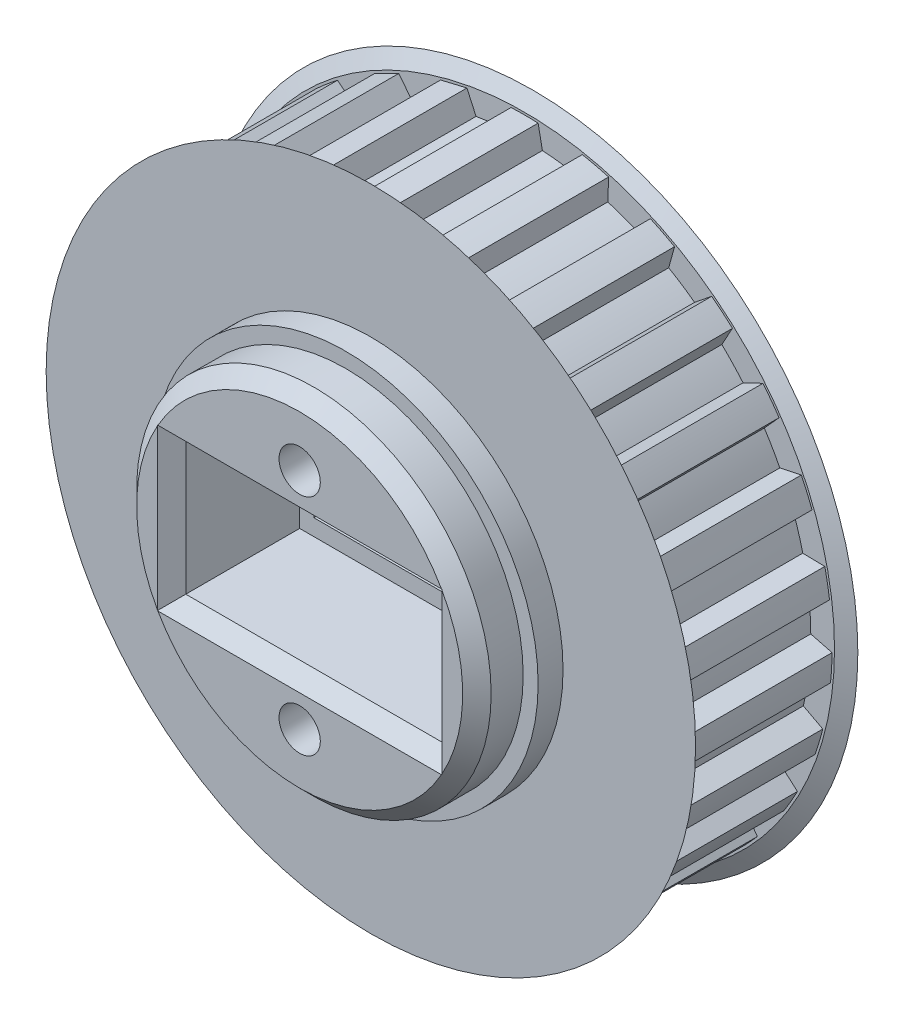
from build123d import *
from build123d.topology import SkipClean

# Parameters (mm, degrees)
CROQUIS1_R                 = 1.5
SALIENTE_EXTRUIR1_DEPTH    = 10.2
CROQUIS2_R                 = 23.5
CROQUIS2_R_2               = 1.5
SALIENTE_EXTRUIR2_DEPTH    = 0.6
SALIENTE_EXTRUIR4_START    = 4.25
CROQUIS4_R                 = 12.45
CROQUIS4_R_2               = 1.5
SALIENTE_EXTRUIR4_DEPTH    = 4.25
SALIENTE_EXTRUIR6_START    = 0.6
CROQUIS6_R                 = 23.5
CROQUIS6_R_2               = 1.5
SALIENTE_EXTRUIR6_DEPTH    = 0.6
SALIENTE_EXTRUIR5_START    = 1.75
CROQUIS5_R                 = 13.5
CROQUIS5_R_2               = 1.5
SALIENTE_EXTRUIR5_DEPTH    = 1.75
CHAFL_N2_SIZE              = 1.732050808
CHAFL_N2_SIZE_2            = 1
CROQUIS3_R                 = 12.45
CROQUIS3_R_2               = 1.5
SALIENTE_EXTRUIR7_DEPTH    = 5
CHAFL_N4_SIZE              = 1
CROQUIS7_R                 = 13.5
CROQUIS7_R_2               = 1.5
SALIENTE_EXTRUIR8_DEPTH    = 1.75
CORTAR_EXTRUIR1_DEPTH      = 36.916220425
CORTAR_EXTRUIR1_DEPTH_BACK = 36.916220425
CROQUIS8_R                 = 1.45
CROQUIS8_W                 = 16
CROQUIS8_H                 = 7
CROQUIS10_W                = 18
CROQUIS10_H                = 9.3
CORTAR_EXTRUIR3_DEPTH      = 9
CHAFL_N5_SIZE              = 1
SKETCH1_R                  = 12.45
SKETCH1_R_2                = 1.45
BOSS_EXTRUDE1_DEPTH        = 5
SKETCH2_R                  = 1.45
CUT_EXTRUDE1_DEPTH         = 38.978117247
SKETCH4_W                  = 8
SKETCH4_H                  = 7
CUT_EXTRUDE2_DEPTH         = 21
CHAMFER3_SIZE              = 1
CHAMFER2_SIZE              = 0.75


# Some blends are built 0.0001 mm under size
with BuildPart() as part:
    # Croquis1 → Saliente-Extruir1 (new body)
    with BuildSketch(Plane.XY):
        with BuildLine():
            Line((-0.95, 21.579098684), (-1.25, 20.061094188))
            ThreePointArc((-1.25, 20.061094188), (-2.333467574, 19.964090991), (-3.410100616, 19.808614636))
            Line((-3.410100616, 19.808614636), (-4.052090006, 21.216516363))
            Line((-4.052090006, 21.216516363), (-5.90087526, 20.778346209))
            Line((-5.90087526, 20.778346209), (-5.842712792, 19.232074959))
            ThreePointArc((-5.842712792, 19.232074959), (-6.874604881, 18.887821678), (-7.886361825, 18.488247542))
            Line((-7.886361825, 18.488247542), (-8.83573079, 19.710146154))
            Line((-8.83573079, 19.710146154), (-10.533632807, 18.857427711))
            Line((-10.533632807, 18.857427711), (-10.120443426, 17.366249591))
            ThreePointArc((-10.120443426, 17.366249591), (-11.045130459, 16.793305009), (-11.937467227, 16.171174237))
            Line((-11.937467227, 16.171174237), (-13.143035041, 17.141196863))
            ThreePointArc((-13.143035041, 17.141196863), (-13.884212369, 16.546559971), (-14.598519483, 15.919900405))
            Line((-14.598519483, 15.919900405), (-13.852578334, 14.564205213))
            ThreePointArc((-13.852578334, 14.564205213), (-14.620210196, 13.793456921), (-15.34502068, 12.982308744))
            Line((-15.34502068, 12.982308744), (-16.741794871, 13.648161213))
            ThreePointArc((-16.741794871, 13.648161213), (-17.325860964, 12.898625581), (-17.876396195, 12.124127147))
            Line((-17.876396195, 12.124127147), (-16.837917159, 10.977000762))
            ThreePointArc((-16.837917159, 10.977000762), (-17.407110616, 10.05), (-17.925320097, 9.093563626))
            Line((-17.925320097, 9.093563626), (-19.438000206, 9.41934966))
            ThreePointArc((-19.438000206, 9.41934966), (-19.833467909, 8.555322946), (-20.190551761, 7.674739056))
            Line((-20.190551761, 7.674739056), (-18.915519512, 6.798023359))
            ThreePointArc((-18.915519512, 6.798023359), (-19.255589198, 5.764744977), (-19.539260868, 4.714582139))
            Line((-19.539260868, 4.714582139), (-21.086297918, 4.682738527))
            ThreePointArc((-21.086297918, 4.682738527), (-21.271847465, 3.750800638), (-21.416229455, 2.811603797))
            Line((-21.416229455, 2.811603797), (-19.973381312, 2.252562756))
            ThreePointArc((-19.973381312, 2.252562756), (-20.065993981, 1.168711061), (-20.099835027, 0.081436309))
            Line((-20.099835027, 0.081436309), (-21.597827852, -0.306320251))
            ThreePointArc((-21.597827852, -0.306320251), (-21.563456219, -1.255928304), (-21.487352677, -2.203105751))
            Line((-21.487352677, -2.203105751), (-19.954472955, -2.414334087))
            ThreePointArc((-19.954472955, -2.414334087), (-19.794635836, -3.490328371), (-19.576821878, -4.556099774))
            Line((-19.576821878, -4.556099774), (-20.945013295, -5.278865225))
            ThreePointArc((-20.945013295, -5.278865225), (-20.692573466, -6.194949827), (-20.400087153, -7.099045298))
            Line((-20.400087153, -7.099045298), (-18.859813796, -6.951073555))
            ThreePointArc((-18.859813796, -6.951073555), (-18.456143748, -7.961203297), (-17.998417194, -8.948015339))
            Line((-17.998417194, -8.948015339), (-19.163047651, -9.966825208))
            ThreePointArc((-19.163047651, -9.966825208), (-18.706148722, -10.8), (-18.213047651, -11.612273475))
            Line((-18.213047651, -11.612273475), (-16.748417194, -11.113078848))
            ThreePointArc((-16.748417194, -11.113078848), (-16.122676174, -12.002887693), (-15.44971318, -12.857541081))
            Line((-15.44971318, -12.857541081), (-16.347997147, -14.117471065))
            ThreePointArc((-16.347997147, -14.117471065), (-15.711270658, -14.822819378), (-15.044138035, -15.499480984))
            Line((-15.044138035, -15.499480984), (-13.734109086, -14.675975185))
            ThreePointArc((-13.734109086, -14.675975185), (-12.920030955, -15.397493307), (-12.06811113, -16.073913455))
            Line((-12.06811113, -16.073913455), (-12.651621886, -17.507040402))
            ThreePointArc((-12.651621886, -17.507040402), (-11.869393926, -18.046536727), (-11.064195045, -18.551107461))
            Line((-11.064195045, -18.551107461), (-9.979391602, -17.4476859))
            ThreePointArc((-9.979391602, -17.4476859), (-9.020863522, -17.962016071), (-8.035914085, -18.423736994))
            Line((-8.035914085, -18.423736994), (-8.273194414, -19.95280066))
            ThreePointArc((-8.273194414, -19.95280066), (-7.387635096, -20.297360609), (-6.487778435, -20.602638932))
            Line((-6.487778435, -20.602638932), (-5.686682533, -19.278787352))
            ThreePointArc((-5.686682533, -19.278787352), (-4.635379002, -19.558201899), (-3.570498832, -19.780332103))
            Line((-3.570498832, -19.780332103), (-3.44875689, -21.32290027))
            ThreePointArc((-3.44875689, -21.32290027), (-2.507606945, -21.453948527), (-1.561604011, -21.543476807))
            Line((-1.561604011, -21.543476807), (-1.087402938, -20.070564388))
            ThreePointArc((-1.087402938, -20.070564388), (0, -20.1), (1.087402938, -20.070564388))
            Line((1.087402938, -20.070564388), (1.561604011, -21.543476807))
            ThreePointArc((1.561604011, -21.543476807), (2.507606945, -21.453948527), (3.44875689, -21.32290027))
            Line((3.44875689, -21.32290027), (3.570498832, -19.780332103))
            ThreePointArc((3.570498832, -19.780332103), (4.635379002, -19.558201899), (5.686682533, -19.278787352))
            Line((5.686682533, -19.278787352), (6.487778435, -20.602638932))
            ThreePointArc((6.487778435, -20.602638932), (7.387635096, -20.297360609), (8.273194414, -19.95280066))
            Line((8.273194414, -19.95280066), (8.035914085, -18.423736994))
            ThreePointArc((8.035914085, -18.423736994), (9.020863522, -17.962016071), (9.979391602, -17.4476859))
            Line((9.979391602, -17.4476859), (11.064195045, -18.551107461))
            ThreePointArc((11.064195045, -18.551107461), (11.869393926, -18.046536727), (12.651621886, -17.507040402))
            Line((12.651621886, -17.507040402), (12.06811113, -16.073913455))
            ThreePointArc((12.06811113, -16.073913455), (12.920030955, -15.397493307), (13.734109086, -14.675975185))
            Line((13.734109086, -14.675975185), (15.044138035, -15.499480984))
            ThreePointArc((15.044138035, -15.499480984), (15.711270658, -14.822819378), (16.347997147, -14.117471065))
            Line((16.347997147, -14.117471065), (15.44971318, -12.857541081))
            ThreePointArc((15.44971318, -12.857541081), (16.122676174, -12.002887693), (16.748417194, -11.113078848))
            Line((16.748417194, -11.113078848), (18.213047651, -11.612273475))
            ThreePointArc((18.213047651, -11.612273475), (18.706148722, -10.8), (19.163047651, -9.966825208))
            Line((19.163047651, -9.966825208), (17.998417194, -8.948015339))
            ThreePointArc((17.998417194, -8.948015339), (18.456143748, -7.961203297), (18.859813796, -6.951073555))
            Line((18.859813796, -6.951073555), (20.400087153, -7.099045298))
            ThreePointArc((20.400087153, -7.099045298), (20.692573466, -6.194949827), (20.945013295, -5.278865225))
            Line((20.945013295, -5.278865225), (19.576821878, -4.556099774))
            ThreePointArc((19.576821878, -4.556099774), (19.794635836, -3.490328371), (19.954472955, -2.414334087))
            Line((19.954472955, -2.414334087), (21.487352677, -2.203105751))
            ThreePointArc((21.487352677, -2.203105751), (21.563456219, -1.255928304), (21.597827852, -0.306320251))
            Line((21.597827852, -0.306320251), (20.099835027, 0.081436309))
            ThreePointArc((20.099835027, 0.081436309), (20.065993981, 1.168711061), (19.973381312, 2.252562756))
            Line((19.973381312, 2.252562756), (21.416229455, 2.811603797))
            ThreePointArc((21.416229455, 2.811603797), (21.271847465, 3.750800638), (21.086297918, 4.682738527))
            Line((21.086297918, 4.682738527), (19.539260868, 4.714582139))
            ThreePointArc((19.539260868, 4.714582139), (19.255589198, 5.764744977), (18.915519512, 6.798023359))
            Line((18.915519512, 6.798023359), (20.190551761, 7.674739056))
            ThreePointArc((20.190551761, 7.674739056), (19.833467909, 8.555322946), (19.438000206, 9.41934966))
            Line((19.438000206, 9.41934966), (17.925320097, 9.093563626))
            ThreePointArc((17.925320097, 9.093563626), (17.407110616, 10.05), (16.837917159, 10.977000762))
            Line((16.837917159, 10.977000762), (17.876396195, 12.124127147))
            ThreePointArc((17.876396195, 12.124127147), (17.325860964, 12.898625581), (16.741794871, 13.648161213))
            Line((16.741794871, 13.648161213), (15.34502068, 12.982308744))
            ThreePointArc((15.34502068, 12.982308744), (14.620210196, 13.793456921), (13.852578334, 14.564205213))
            Line((13.852578334, 14.564205213), (14.598519483, 15.919900405))
            ThreePointArc((14.598519483, 15.919900405), (13.884212369, 16.546559971), (13.143035041, 17.141196863))
            Line((13.143035041, 17.141196863), (11.937467227, 16.171174237))
            ThreePointArc((11.937467227, 16.171174237), (11.045130459, 16.793305009), (10.120443426, 17.366249591))
            Line((10.120443426, 17.366249591), (10.533632807, 18.857427711))
            ThreePointArc((10.533632807, 18.857427711), (9.694062292, 19.302465031), (8.83573079, 19.710146154))
            Line((8.83573079, 19.710146154), (7.886361825, 18.488247542))
            ThreePointArc((7.886361825, 18.488247542), (6.874604881, 18.887821678), (5.842712792, 19.232074959))
            Line((5.842712792, 19.232074959), (5.90087526, 20.778346209))
            ThreePointArc((5.90087526, 20.778346209), (4.981302808, 21.017769205), (4.052090006, 21.216516363))
            Line((4.052090006, 21.216516363), (3.410100616, 19.808614636))
            ThreePointArc((3.410100616, 19.808614636), (2.333467574, 19.964090991), (1.25, 20.061094188))
            Line((1.25, 20.061094188), (0.95, 21.579098684))
            ThreePointArc((0.95, 21.579098684), (0, 21.6), (-0.95, 21.579098684))
        make_face()
        Circle(CROQUIS1_R, mode=Mode.SUBTRACT)
    extrude(amount=SALIENTE_EXTRUIR1_DEPTH)

    # Croquis2 → Saliente-Extruir2 (add)
    with BuildSketch(Plane.XY.offset(10.2)):
        Circle(CROQUIS2_R)
        Circle(CROQUIS2_R_2, mode=Mode.SUBTRACT)
    extrude(amount=SALIENTE_EXTRUIR2_DEPTH)

    # Croquis4 → Saliente-Extruir4 (add)
    with BuildSketch(Plane(origin=(0, 0, 0), x_dir=(-1, 0, 0), z_dir=(0, 0, -1)).offset(SALIENTE_EXTRUIR4_START)):
        with Locations(Location((0, 0, 0), (0, 0, 180))):
            Circle(CROQUIS4_R)
        Circle(CROQUIS4_R_2, mode=Mode.SUBTRACT)
    extrude(amount=-SALIENTE_EXTRUIR4_DEPTH)

    # Croquis6 → Saliente-Extruir6 (add)
    with SkipClean():  # the faces are left unmerged after this step: merging them gives an invalid solid
        with BuildSketch(Plane(origin=(0, 0, 0), x_dir=(-1, 0, 0), z_dir=(0, 0, -1)).offset(SALIENTE_EXTRUIR6_START)):
            with Locations(Location((0, 0, 0), (0, 0, 180))):
                Circle(CROQUIS6_R)
            Circle(CROQUIS6_R_2, mode=Mode.SUBTRACT)
        extrude(amount=-SALIENTE_EXTRUIR6_DEPTH)

    # Croquis5 → Saliente-Extruir5 (add)
    with SkipClean():  # the faces are left unmerged after this step: merging them gives an invalid solid
        with BuildSketch(Plane(origin=(0, 0, -0.6), x_dir=(-1, 0, 0), z_dir=(0, 0, -1)).offset(SALIENTE_EXTRUIR5_START)):
            Circle(CROQUIS5_R)
            Circle(CROQUIS5_R_2, mode=Mode.SUBTRACT)
        extrude(amount=-SALIENTE_EXTRUIR5_DEPTH)

    # Chaflán2
    # the kernel refuses this chamfer: 1.732050808, 1 mm, written as the material it takes off along each edge
    with BuildSketch(Plane(origin=(0, 0, 0), x_dir=(1, 0, 0), z_dir=(0, 1, 0))) as chafl_n2_piece_1:
        Polygon((23.5 - CHAFL_N2_SIZE, 0), (23.5, CHAFL_N2_SIZE_2), (23.5, 0), align=None)
    revolve(axis=Axis((0, 0, 0), (0, 0, -1)), mode=Mode.SUBTRACT)
    with BuildSketch(Plane(origin=(0, 0, 10.2), x_dir=(1, 0, 0), z_dir=(0, -1, 0))) as chafl_n2_piece_2:
        Polygon((23.5 - CHAFL_N2_SIZE, 0), (23.5, CHAFL_N2_SIZE_2), (23.5, 0), align=None)
    revolve(axis=Axis((0, 0, 10.2), (0, 0, 1)), mode=Mode.SUBTRACT)

    # Croquis3 → Saliente-Extruir7 (add)
    with BuildSketch(Plane.XY.offset(10.8)):
        with Locations(Location((0, 0, 0), (0, 0, 180))):
            Circle(CROQUIS3_R)
        with Locations(Location((0, 0, 0), (0, 0, 180))):
            Circle(CROQUIS3_R_2, mode=Mode.SUBTRACT)
    extrude(amount=SALIENTE_EXTRUIR7_DEPTH)

    # Chaflán4
    chafl_n4_edges = [part.edges().sort_by_distance(p)[0] for p in [
        (12.45, 0, 15.8),
    ]]
    chamfer(chafl_n4_edges, length=CHAFL_N4_SIZE)

    # Croquis7 → Saliente-Extruir8 (add)
    with BuildSketch(Plane.XY.offset(10.8)):
        with Locations(Location((0, 0, 0), (0, 0, 180))):
            Circle(CROQUIS7_R)
        with Locations(Location((0, 0, 0), (0, 0, 180))):
            Circle(CROQUIS7_R_2, mode=Mode.SUBTRACT)
    extrude(amount=SALIENTE_EXTRUIR8_DEPTH)

    # Croquis8 → Cortar-Extruir1 (cut, two sides: drawn at the far end of the back side and taken through both)
    with BuildSketch(Plane.XY.offset(-CORTAR_EXTRUIR1_DEPTH_BACK)):
        with Locations((0, 7.875631857)):
            Circle(CROQUIS8_R)
        with Locations((0, -7.875631857)):
            Circle(CROQUIS8_R)
        Rectangle(CROQUIS8_W, CROQUIS8_H)
    extrude(amount=CORTAR_EXTRUIR1_DEPTH + CORTAR_EXTRUIR1_DEPTH_BACK, mode=Mode.SUBTRACT)

    # Croquis10 → Cortar-Extruir3 (cut)
    with BuildSketch(Plane.XY.offset(15.8)):
        Rectangle(CROQUIS10_W, CROQUIS10_H)
    extrude(amount=-CORTAR_EXTRUIR3_DEPTH, mode=Mode.SUBTRACT)

    # Chaflán5
    # the kernel refuses this chamfer: 1 mm, written as the material it takes off along each edge
    with BuildSketch(Plane(origin=(8, 3.5, -4.25), x_dir=(0.9996219169112968, 0, -0.02749587661058651), z_dir=(0, -1, 0)), Plane(origin=(-8, -3.5, -4.25), x_dir=(-0.9996219169112968, 0, -0.02749587661058651), z_dir=(0, 1, 0))) as chafl_n5_piece_1:
        Polygon((CHAFL_N5_SIZE * 0.999621916911, CHAFL_N5_SIZE * 0.0274958766106), (-CHAFL_N5_SIZE * 0.0274958766106, CHAFL_N5_SIZE * 0.999621916911), (0, 0), align=None)
    extrude(amount=7, mode=Mode.SUBTRACT)
    with BuildSketch(Plane(origin=(8, -3.5, -4.25), x_dir=(0, -0.9996219169112968, -0.027495876610586497), z_dir=(-1, 0, 0)), Plane(origin=(-8, 3.5, -4.25), x_dir=(0, 0.9996219169112968, -0.027495876610586487), z_dir=(1, 0, 0))) as chafl_n5_piece_2:
        Polygon((CHAFL_N5_SIZE * 0.999621916911, CHAFL_N5_SIZE * 0.0274958766106), (-CHAFL_N5_SIZE * 0.0274958766106, CHAFL_N5_SIZE * 0.999621916911), (0, 0), align=None)
    extrude(amount=16, mode=Mode.SUBTRACT)
    with BuildSketch(Plane(origin=(-9, 4.65, 15.8), x_dir=(-0.9996219169112968, 0, 0.027495876610585647), z_dir=(0, -1, 0)), Plane(origin=(9, -4.65, 15.8), x_dir=(0.9996219169112968, 0, 0.027495876610585647), z_dir=(0, 1, 0))) as chafl_n5_piece_3:
        Polygon((CHAFL_N5_SIZE * 0.999621916911, CHAFL_N5_SIZE * 0.0274958766106), (-CHAFL_N5_SIZE * 0.0274958766106, CHAFL_N5_SIZE * 0.999621916911), (0, 0), align=None)
    extrude(amount=9.3, mode=Mode.SUBTRACT)
    with BuildSketch(Plane(origin=(-9, -4.65, 15.8), x_dir=(0, -0.9996219169112968, 0.027495876610585623), z_dir=(1, 0, 0)), Plane(origin=(9, 4.65, 15.8), x_dir=(0, 0.9996219169112968, 0.027495876610585623), z_dir=(-1, 0, 0))) as chafl_n5_piece_4:
        Polygon((CHAFL_N5_SIZE * 0.999621916911, CHAFL_N5_SIZE * 0.0274958766106), (-CHAFL_N5_SIZE * 0.0274958766106, CHAFL_N5_SIZE * 0.999621916911), (0, 0), align=None)
    extrude(amount=18, mode=Mode.SUBTRACT)
    with BuildSketch(Plane(origin=(-8, 3.5, -4.25), x_dir=(0, 0.9996219169112968, -0.027495876610586487), z_dir=(1, 0, 0))) as chafl_n5_piece_5a_section:
        Polygon((CHAFL_N5_SIZE * 0.999621916911, CHAFL_N5_SIZE * 0.0274958766106), (-CHAFL_N5_SIZE * 0.0274958766106, CHAFL_N5_SIZE * 0.999621916911), (0, 0), align=None)
    chafl_n5_piece_5a = extrude(amount=18.571682988, mode=Mode.PRIVATE)
    chafl_n5_piece_5a = split(chafl_n5_piece_5a, bisect_by=Plane(origin=(8, 3.829793627, -3.920206373), z_dir=(1, 0, 0)), keep=Keep.TOP, mode=Mode.PRIVATE)
    with BuildSketch(Plane(origin=(8, 6.071682988, -4.25), x_dir=(0.9996219169112968, 0, -0.02749587661058651), z_dir=(0, -1, 0))) as chafl_n5_piece_5b_section:
        Polygon((CHAFL_N5_SIZE * 0.999621916911, CHAFL_N5_SIZE * 0.0274958766106), (-CHAFL_N5_SIZE * 0.0274958766106, CHAFL_N5_SIZE * 0.999621916911), (0, 0), align=None)
    chafl_n5_piece_5b = extrude(amount=9.571682988, mode=Mode.PRIVATE)
    chafl_n5_piece_5b = split(chafl_n5_piece_5b, bisect_by=Plane(origin=(8.329793627, 3.5, -3.920206373), z_dir=(0, 1, 0)), keep=Keep.TOP, mode=Mode.PRIVATE)
    chafl_n5_piece_5 = chafl_n5_piece_5a & chafl_n5_piece_5b
    add(chafl_n5_piece_5, mode=Mode.SUBTRACT)
    with BuildSketch(Plane(origin=(8, 3.5, -4.25), x_dir=(0.9996219169112968, 0, -0.02749587661058651), z_dir=(0, -1, 0))) as chafl_n5_piece_6a_section:
        Polygon((CHAFL_N5_SIZE * 0.999621916911, CHAFL_N5_SIZE * 0.0274958766106), (-CHAFL_N5_SIZE * 0.0274958766106, CHAFL_N5_SIZE * 0.999621916911), (0, 0), align=None)
    chafl_n5_piece_6a = extrude(amount=9.571682988, mode=Mode.PRIVATE)
    chafl_n5_piece_6a = split(chafl_n5_piece_6a, bisect_by=Plane(origin=(8.329793627, -3.5, -3.920206373), z_dir=(0, -1, 0)), keep=Keep.TOP, mode=Mode.PRIVATE)
    with BuildSketch(Plane(origin=(10.571682988, -3.5, -4.25), x_dir=(0, -0.9996219169112968, -0.027495876610586497), z_dir=(-1, 0, 0))) as chafl_n5_piece_6b_section:
        Polygon((CHAFL_N5_SIZE * 0.999621916911, CHAFL_N5_SIZE * 0.0274958766106), (-CHAFL_N5_SIZE * 0.0274958766106, CHAFL_N5_SIZE * 0.999621916911), (0, 0), align=None)
    chafl_n5_piece_6b = extrude(amount=18.571682988, mode=Mode.PRIVATE)
    chafl_n5_piece_6b = split(chafl_n5_piece_6b, bisect_by=Plane(origin=(8, -3.829793627, -3.920206373), z_dir=(1, 0, 0)), keep=Keep.TOP, mode=Mode.PRIVATE)
    chafl_n5_piece_6 = chafl_n5_piece_6a & chafl_n5_piece_6b
    add(chafl_n5_piece_6, mode=Mode.SUBTRACT)
    with BuildSketch(Plane(origin=(8, -3.5, -4.25), x_dir=(0, -0.9996219169112968, -0.027495876610586497), z_dir=(-1, 0, 0))) as chafl_n5_piece_7a_section:
        Polygon((CHAFL_N5_SIZE * 0.999621916911, CHAFL_N5_SIZE * 0.0274958766106), (-CHAFL_N5_SIZE * 0.0274958766106, CHAFL_N5_SIZE * 0.999621916911), (0, 0), align=None)
    chafl_n5_piece_7a = extrude(amount=18.571682988, mode=Mode.PRIVATE)
    chafl_n5_piece_7a = split(chafl_n5_piece_7a, bisect_by=Plane(origin=(-8, -3.829793627, -3.920206373), z_dir=(-1, 0, 0)), keep=Keep.TOP, mode=Mode.PRIVATE)
    with BuildSketch(Plane(origin=(-8, -6.071682988, -4.25), x_dir=(-0.9996219169112968, 0, -0.02749587661058651), z_dir=(0, 1, 0))) as chafl_n5_piece_7b_section:
        Polygon((CHAFL_N5_SIZE * 0.999621916911, CHAFL_N5_SIZE * 0.0274958766106), (-CHAFL_N5_SIZE * 0.0274958766106, CHAFL_N5_SIZE * 0.999621916911), (0, 0), align=None)
    chafl_n5_piece_7b = extrude(amount=9.571682988, mode=Mode.PRIVATE)
    chafl_n5_piece_7b = split(chafl_n5_piece_7b, bisect_by=Plane(origin=(-8.329793627, -3.5, -3.920206373), z_dir=(0, -1, 0)), keep=Keep.TOP, mode=Mode.PRIVATE)
    chafl_n5_piece_7 = chafl_n5_piece_7a & chafl_n5_piece_7b
    add(chafl_n5_piece_7, mode=Mode.SUBTRACT)
    with BuildSketch(Plane(origin=(-10.571682988, 3.5, -4.25), x_dir=(0, 0.9996219169112968, -0.027495876610586487), z_dir=(1, 0, 0))) as chafl_n5_piece_8a_section:
        Polygon((CHAFL_N5_SIZE * 0.999621916911, CHAFL_N5_SIZE * 0.0274958766106), (-CHAFL_N5_SIZE * 0.0274958766106, CHAFL_N5_SIZE * 0.999621916911), (0, 0), align=None)
    chafl_n5_piece_8a = extrude(amount=18.571682988, mode=Mode.PRIVATE)
    chafl_n5_piece_8a = split(chafl_n5_piece_8a, bisect_by=Plane(origin=(-8, 3.829793627, -3.920206373), z_dir=(-1, 0, 0)), keep=Keep.TOP, mode=Mode.PRIVATE)
    with BuildSketch(Plane(origin=(-8, -3.5, -4.25), x_dir=(-0.9996219169112968, 0, -0.02749587661058651), z_dir=(0, 1, 0))) as chafl_n5_piece_8b_section:
        Polygon((CHAFL_N5_SIZE * 0.999621916911, CHAFL_N5_SIZE * 0.0274958766106), (-CHAFL_N5_SIZE * 0.0274958766106, CHAFL_N5_SIZE * 0.999621916911), (0, 0), align=None)
    chafl_n5_piece_8b = extrude(amount=9.571682988, mode=Mode.PRIVATE)
    chafl_n5_piece_8b = split(chafl_n5_piece_8b, bisect_by=Plane(origin=(-8.329793627, 3.5, -3.920206373), z_dir=(0, 1, 0)), keep=Keep.TOP, mode=Mode.PRIVATE)
    chafl_n5_piece_8 = chafl_n5_piece_8a & chafl_n5_piece_8b
    add(chafl_n5_piece_8, mode=Mode.SUBTRACT)
    with BuildSketch(Plane(origin=(9, 4.65, 15.8), x_dir=(0, 0.9996219169112968, 0.027495876610585623), z_dir=(-1, 0, 0))) as chafl_n5_piece_9a_section:
        Polygon((CHAFL_N5_SIZE * 0.999621916911, CHAFL_N5_SIZE * 0.0274958766106), (-CHAFL_N5_SIZE * 0.0274958766106, CHAFL_N5_SIZE * 0.999621916911), (0, 0), align=None)
    chafl_n5_piece_9a = extrude(amount=20.571682988, mode=Mode.PRIVATE)
    chafl_n5_piece_9a = split(chafl_n5_piece_9a, bisect_by=Plane(origin=(-9, 4.979793627, 15.470206373), z_dir=(-1, 0, 0)), keep=Keep.TOP, mode=Mode.PRIVATE)
    with BuildSketch(Plane(origin=(-9, 7.221682988, 15.8), x_dir=(-0.9996219169112968, 0, 0.027495876610585647), z_dir=(0, -1, 0))) as chafl_n5_piece_9b_section:
        Polygon((CHAFL_N5_SIZE * 0.999621916911, CHAFL_N5_SIZE * 0.0274958766106), (-CHAFL_N5_SIZE * 0.0274958766106, CHAFL_N5_SIZE * 0.999621916911), (0, 0), align=None)
    chafl_n5_piece_9b = extrude(amount=11.871682988, mode=Mode.PRIVATE)
    chafl_n5_piece_9b = split(chafl_n5_piece_9b, bisect_by=Plane(origin=(-9.329793627, 4.65, 15.470206373), z_dir=(0, 1, 0)), keep=Keep.TOP, mode=Mode.PRIVATE)
    chafl_n5_piece_9 = chafl_n5_piece_9a & chafl_n5_piece_9b
    add(chafl_n5_piece_9, mode=Mode.SUBTRACT)
    with BuildSketch(Plane(origin=(-9, 4.65, 15.8), x_dir=(-0.9996219169112968, 0, 0.027495876610585647), z_dir=(0, -1, 0))) as chafl_n5_piece_10a_section:
        Polygon((CHAFL_N5_SIZE * 0.999621916911, CHAFL_N5_SIZE * 0.0274958766106), (-CHAFL_N5_SIZE * 0.0274958766106, CHAFL_N5_SIZE * 0.999621916911), (0, 0), align=None)
    chafl_n5_piece_10a = extrude(amount=11.871682988, mode=Mode.PRIVATE)
    chafl_n5_piece_10a = split(chafl_n5_piece_10a, bisect_by=Plane(origin=(-9.329793627, -4.65, 15.470206373), z_dir=(0, -1, 0)), keep=Keep.TOP, mode=Mode.PRIVATE)
    with BuildSketch(Plane(origin=(-11.571682988, -4.65, 15.8), x_dir=(0, -0.9996219169112968, 0.027495876610585623), z_dir=(1, 0, 0))) as chafl_n5_piece_10b_section:
        Polygon((CHAFL_N5_SIZE * 0.999621916911, CHAFL_N5_SIZE * 0.0274958766106), (-CHAFL_N5_SIZE * 0.0274958766106, CHAFL_N5_SIZE * 0.999621916911), (0, 0), align=None)
    chafl_n5_piece_10b = extrude(amount=20.571682988, mode=Mode.PRIVATE)
    chafl_n5_piece_10b = split(chafl_n5_piece_10b, bisect_by=Plane(origin=(-9, -4.979793627, 15.470206373), z_dir=(-1, 0, 0)), keep=Keep.TOP, mode=Mode.PRIVATE)
    chafl_n5_piece_10 = chafl_n5_piece_10a & chafl_n5_piece_10b
    add(chafl_n5_piece_10, mode=Mode.SUBTRACT)
    with BuildSketch(Plane(origin=(-9, -4.65, 15.8), x_dir=(0, -0.9996219169112968, 0.027495876610585623), z_dir=(1, 0, 0))) as chafl_n5_piece_11a_section:
        Polygon((CHAFL_N5_SIZE * 0.999621916911, CHAFL_N5_SIZE * 0.0274958766106), (-CHAFL_N5_SIZE * 0.0274958766106, CHAFL_N5_SIZE * 0.999621916911), (0, 0), align=None)
    chafl_n5_piece_11a = extrude(amount=20.571682988, mode=Mode.PRIVATE)
    chafl_n5_piece_11a = split(chafl_n5_piece_11a, bisect_by=Plane(origin=(9, -4.979793627, 15.470206373), z_dir=(1, 0, 0)), keep=Keep.TOP, mode=Mode.PRIVATE)
    with BuildSketch(Plane(origin=(9, -7.221682988, 15.8), x_dir=(0.9996219169112968, 0, 0.027495876610585647), z_dir=(0, 1, 0))) as chafl_n5_piece_11b_section:
        Polygon((CHAFL_N5_SIZE * 0.999621916911, CHAFL_N5_SIZE * 0.0274958766106), (-CHAFL_N5_SIZE * 0.0274958766106, CHAFL_N5_SIZE * 0.999621916911), (0, 0), align=None)
    chafl_n5_piece_11b = extrude(amount=11.871682988, mode=Mode.PRIVATE)
    chafl_n5_piece_11b = split(chafl_n5_piece_11b, bisect_by=Plane(origin=(9.329793627, -4.65, 15.470206373), z_dir=(0, -1, 0)), keep=Keep.TOP, mode=Mode.PRIVATE)
    chafl_n5_piece_11 = chafl_n5_piece_11a & chafl_n5_piece_11b
    add(chafl_n5_piece_11, mode=Mode.SUBTRACT)
    with BuildSketch(Plane(origin=(11.571682988, 4.65, 15.8), x_dir=(0, 0.9996219169112968, 0.027495876610585623), z_dir=(-1, 0, 0))) as chafl_n5_piece_12a_section:
        Polygon((CHAFL_N5_SIZE * 0.999621916911, CHAFL_N5_SIZE * 0.0274958766106), (-CHAFL_N5_SIZE * 0.0274958766106, CHAFL_N5_SIZE * 0.999621916911), (0, 0), align=None)
    chafl_n5_piece_12a = extrude(amount=20.571682988, mode=Mode.PRIVATE)
    chafl_n5_piece_12a = split(chafl_n5_piece_12a, bisect_by=Plane(origin=(9, 4.979793627, 15.470206373), z_dir=(1, 0, 0)), keep=Keep.TOP, mode=Mode.PRIVATE)
    with BuildSketch(Plane(origin=(9, -4.65, 15.8), x_dir=(0.9996219169112968, 0, 0.027495876610585647), z_dir=(0, 1, 0))) as chafl_n5_piece_12b_section:
        Polygon((CHAFL_N5_SIZE * 0.999621916911, CHAFL_N5_SIZE * 0.0274958766106), (-CHAFL_N5_SIZE * 0.0274958766106, CHAFL_N5_SIZE * 0.999621916911), (0, 0), align=None)
    chafl_n5_piece_12b = extrude(amount=11.871682988, mode=Mode.PRIVATE)
    chafl_n5_piece_12b = split(chafl_n5_piece_12b, bisect_by=Plane(origin=(9.329793627, 4.65, 15.470206373), z_dir=(0, 1, 0)), keep=Keep.TOP, mode=Mode.PRIVATE)
    chafl_n5_piece_12 = chafl_n5_piece_12a & chafl_n5_piece_12b
    add(chafl_n5_piece_12, mode=Mode.SUBTRACT)

    # Sketch1 → Boss-Extrude1 (add)
    with BuildSketch(Plane(origin=(0, 0, -4.25), x_dir=(-1, 0, 0), z_dir=(0, 0, -1))):
        Circle(SKETCH1_R)
        with Locations(Location((0, 7.875631857, 0), (0, 0, 180))):
            Circle(SKETCH1_R_2, mode=Mode.SUBTRACT)
        with Locations(Location((0, -7.875631857, 0), (0, 0, 180))):
            Circle(SKETCH1_R_2, mode=Mode.SUBTRACT)
    extrude(amount=-BOSS_EXTRUDE1_DEPTH)

    # Sketch2 → Cut-Extrude1 (cut, through all)
    with BuildSketch(Plane(origin=(0, 0, -4.25), x_dir=(-1, 0, 0), z_dir=(0, 0, -1))):
        with Locations((-7.5, 0)):
            Circle(SKETCH2_R)
        with Locations(Location((7.5, 0, 0), (0, 0, 69.828728654))):
            Circle(SKETCH2_R)
    extrude(amount=-CUT_EXTRUDE1_DEPTH, mode=Mode.SUBTRACT)

    # Sketch4 → Cut-Extrude2 (cut)
    with BuildSketch(Plane.XY.offset(15.8)):
        Rectangle(SKETCH4_W, SKETCH4_H)
    extrude(amount=-CUT_EXTRUDE2_DEPTH, mode=Mode.SUBTRACT)

    # Chamfer3
    chamfer3_edges = [part.edges().sort_by_distance(p)[0] for p in [
        (-4, 0, -4.25),
        (0, 3.5, -4.25),
        (4, 0, -4.25),
        (0, -3.5, -4.25),
    ]]
    chamfer(chamfer3_edges, length=CHAMFER3_SIZE - 0.0001)  # a hair under: the kernel refuses the full size

    # Chamfer2
    chamfer2_edges = [part.edges().sort_by_distance(p)[0] for p in [
        (-12.45, 0, -4.25),
    ]]
    chamfer(chamfer2_edges, length=CHAMFER2_SIZE)


solid = part.part
